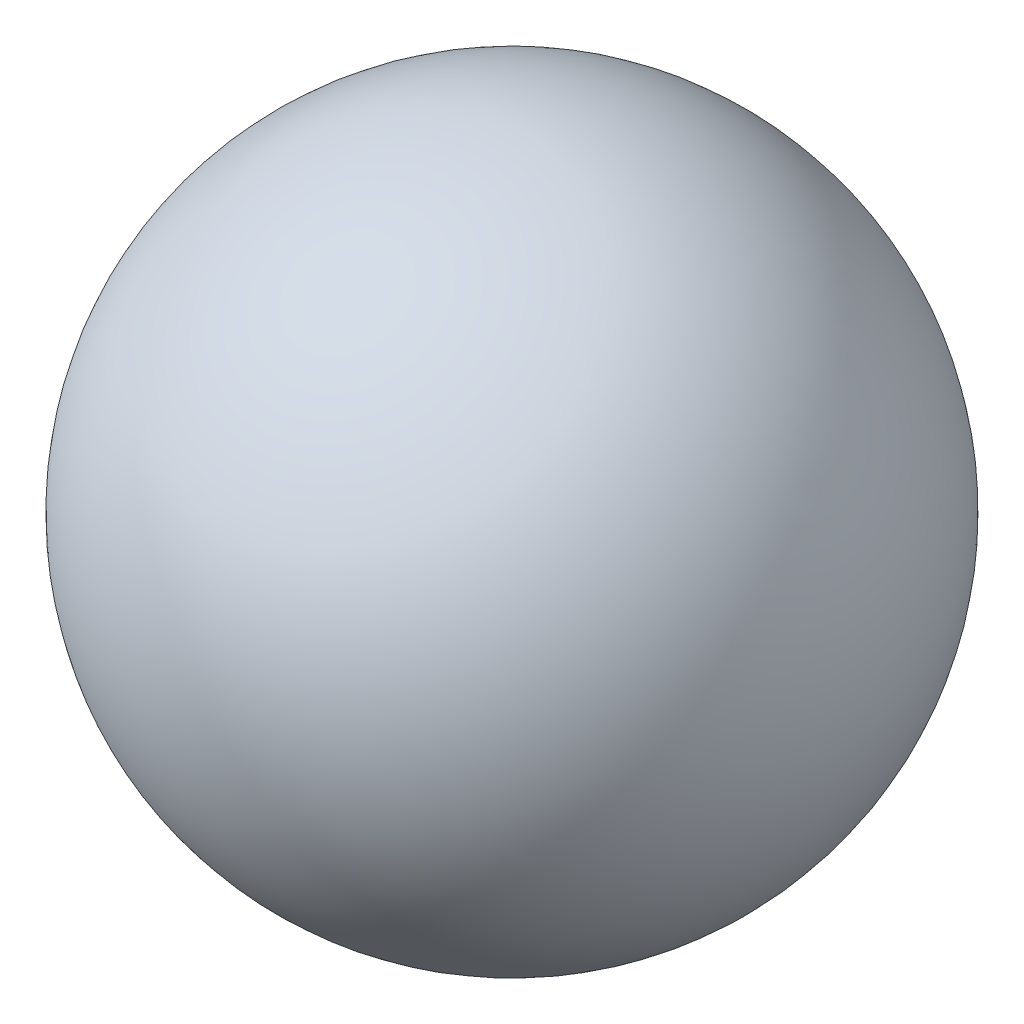
from build123d import *


with BuildPart() as part:
    # Sketch3 → Revolve1 (revolve)
    with BuildSketch(Plane.XY):
        with BuildLine():
            Line((52.522997744, 55.206654563), (-52.522997744, -55.206654563))
            ThreePointArc((-52.522997744, -55.206654563), (55.206654563, -52.522997744), (52.522997744, 55.206654563))
        make_face()
    revolve(axis=Axis((52.522997744, 55.206654563, 0), (-0.6892781856133154, -0.7244967790388138, 0)))


solid = part.part
